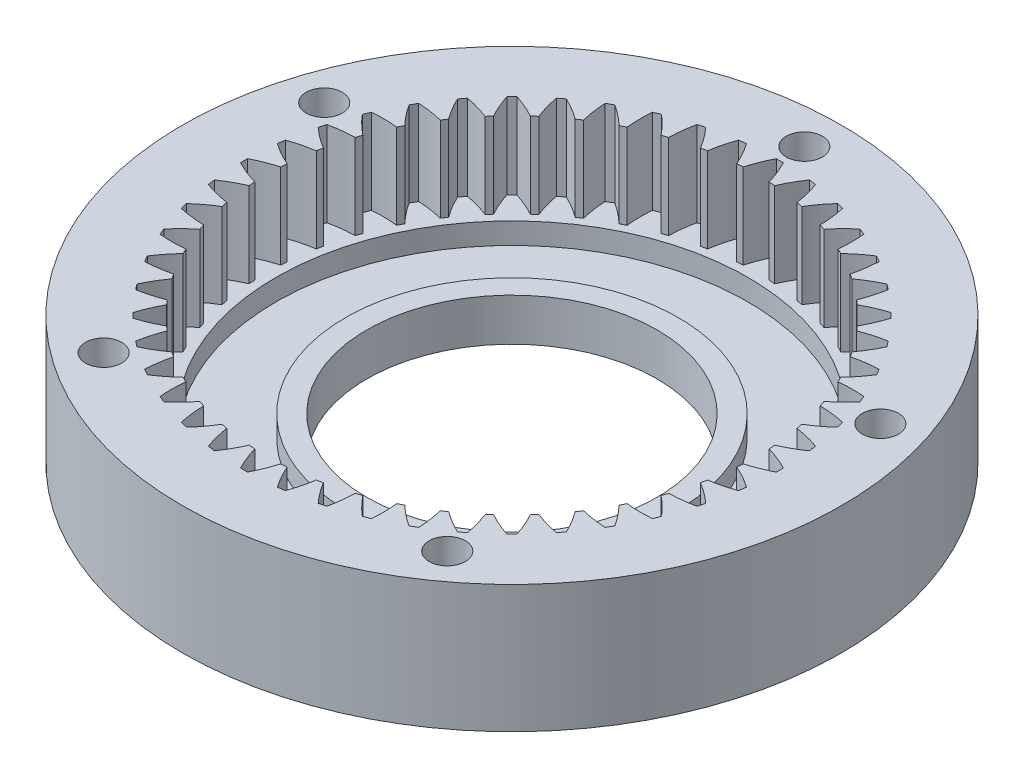
from build123d import *

# Parameters (mm, degrees)
ESQUISSE1_R                                  = 31
ESQUISSE1_R_2                                = 13.65
ESQUISSE1_R_3                                = 1.7
BOSS_EXTRU_1_DEPTH                           = 2
ESQUISSE2_R                                  = 15.65
ESQUISSE2_R_2                                = 13.65
BOSS_EXTRU_2_DEPTH                           = 2
ESQUISSE3_R                                  = 31
ESQUISSE3_R_2                                = 25.2
BOSS_EXTRU_3_DEPTH                           = 10
ESQUISSE7_R                                  = 1.7
ENL_V_MAT_EXTRU_2_DEPTH                      = 46.453272709
ESQUISSE8_R                                  = 25.2
ESQUISSE8_R_2                                = 22.2
BOSS_EXTRU_4_DEPTH                           = 2
ISO_START                                    = -0.630640537
ISO_INTERNAL_SPUR_GEAR_1M_48T_20PA_2_R       = 25.2764
ISO_INTERNAL_SPUR_GEAR_1M_48T_20PA_8FW_DEPTH = 8
CORPS_D_PLACER_COPIER6_ANGLE                 = 90


with BuildPart() as part:
    # Esquisse1 → Boss.-Extru.1 (new body)
    with BuildSketch(Plane(origin=(0, 0, 0), x_dir=(1, 0, 0), z_dir=(0, 1, 0))):
        with Locations(Location((0, 0, 0), (0, 0, 270))):
            Circle(ESQUISSE1_R)
        with Locations(Location((0, 0, 0), (0, 0, 270))):
            Circle(ESQUISSE1_R_2, mode=Mode.SUBTRACT)
        with Locations(Location((0, 27.5, 0), (0, 0, 270))):
            Circle(ESQUISSE1_R_3, mode=Mode.SUBTRACT)
        with Locations(Location((26.154054198, 8.497967345, 0), (0, 0, 270))):
            Circle(ESQUISSE1_R_3, mode=Mode.SUBTRACT)
        with Locations(Location((16.164094438, -22.247967345, 0), (0, 0, 270))):
            Circle(ESQUISSE1_R_3, mode=Mode.SUBTRACT)
        with Locations(Location((-16.164094438, -22.247967345, 0), (0, 0, 270))):
            Circle(ESQUISSE1_R_3, mode=Mode.SUBTRACT)
        with Locations(Location((-26.154054198, 8.497967345, 0), (0, 0, 270))):
            Circle(ESQUISSE1_R_3, mode=Mode.SUBTRACT)
    extrude(amount=BOSS_EXTRU_1_DEPTH)

    # Esquisse2 → Boss.-Extru.2 (add)
    with BuildSketch(Plane(origin=(0, 2, 0), x_dir=(1, 0, 0), z_dir=(0, 1, 0))):
        with Locations(Location((0, 0, 0), (0, 0, 270))):
            Circle(ESQUISSE2_R)
        with Locations(Location((0, 0, 0), (0, 0, 270))):
            Circle(ESQUISSE2_R_2, mode=Mode.SUBTRACT)
    extrude(amount=BOSS_EXTRU_2_DEPTH)

    # Esquisse3 → Boss.-Extru.3 (add)
    with BuildSketch(Plane(origin=(0, 2, 0), x_dir=(1, 0, 0), z_dir=(0, 1, 0))):
        with Locations(Location((0, 0, 0), (0, 0, 270))):
            Circle(ESQUISSE3_R)
        with Locations(Location((0, 0, 0), (0, 0, 270))):
            Circle(ESQUISSE3_R_2, mode=Mode.SUBTRACT)
    extrude(amount=BOSS_EXTRU_3_DEPTH)

    # Esquisse7 → Enlèv. mat.-Extru.2 (cut, through all)
    with BuildSketch(Plane.XZ):
        with Locations(Location((-26.154054198, -8.497967345, 0), (0, 0, 270))):
            Circle(ESQUISSE7_R)
        with Locations(Location((0, -27.5, 0), (0, 0, 270))):
            Circle(ESQUISSE7_R)
        with Locations(Location((26.154054198, -8.497967345, 0), (0, 0, 270))):
            Circle(ESQUISSE7_R)
        with Locations(Location((-16.164094438, 22.247967345, 0), (0, 0, 270))):
            Circle(ESQUISSE7_R)
        with Locations(Location((16.164094438, 22.247967345, 0), (0, 0, 270))):
            Circle(ESQUISSE7_R)
    extrude(amount=-ENL_V_MAT_EXTRU_2_DEPTH, mode=Mode.SUBTRACT)

    # Esquisse8 → Boss.-Extru.4 (add)
    with BuildSketch(Plane(origin=(0, 2, 0), x_dir=(1, 0, 0), z_dir=(0, 1, 0))):
        with Locations(Location((0, 0, 0), (0, 0, 270))):
            Circle(ESQUISSE8_R)
        with Locations(Location((0, 0, 0), (0, 0, 270))):
            Circle(ESQUISSE8_R_2, mode=Mode.SUBTRACT)
    extrude(amount=BOSS_EXTRU_4_DEPTH)


with BuildPart() as body_2:
    # ISO - Internal spur gear 1M 48T 20PA 8FW: read off the stored shape, not the designer's step
    # ISO - Internal spur gear 1M 48T 20PA 2 → ISO - Internal spur gear 1M 48T 20PA 8FW (new body)
    with BuildSketch(Plane.YZ.offset(ISO_START)):
        with Locations((15.09894857, -0.288936631)):
            Circle(ISO_INTERNAL_SPUR_GEAR_1M_48T_20PA_2_R)
        with BuildLine():
            ThreePointArc((40.348095514, -0.594844444), (39.230800177, -1.110970375), (38.06651592, -1.50994032))
            ThreePointArc((38.06651592, -1.50994032), (38.049703804, -1.793208603), (38.02939816, -2.076247908))
            ThreePointArc((38.02939816, -2.076247908), (39.131645776, -2.6237742), (40.172014544, -3.281320909))
            ThreePointArc((40.172014544, -3.281320909), (40.133922764, -3.58485351), (40.09215658, -3.887902367))
            ThreePointArc((40.09215658, -3.887902367), (38.917051907, -4.253776464), (37.710652235, -4.497363575))
            ThreePointArc((37.710652235, -4.497363575), (37.657010019, -4.776014037), (37.599934049, -5.053981483))
            ThreePointArc((37.599934049, -5.053981483), (38.621285262, -5.740695796), (39.566926463, -6.528412475))
            ThreePointArc((39.566926463, -6.528412475), (39.489541609, -6.824376338), (39.408576927, -7.11938099))
            ThreePointArc((39.408576927, -7.11938099), (38.195769284, -7.328743044), (36.967896031, -7.412779478))
            ThreePointArc((36.967896031, -7.412779478), (36.878341548, -7.682044332), (36.785471839, -7.950183819))
            ThreePointArc((36.785471839, -7.950183819), (37.708451046, -8.764336281), (38.543184497, -9.66874488))
            ThreePointArc((38.543184497, -9.66874488), (38.427830645, -9.952075981), (38.309052793, -10.233988815))
            ThreePointArc((38.309052793, -10.233988815), (37.079293656, -10.283256585), (35.850956073, -10.206304455))
            ThreePointArc((35.850956073, -10.206304455), (35.727021625, -10.461576506), (35.599947203, -10.715300092))
            ThreePointArc((35.599947203, -10.715300092), (36.408761974, -11.642960329), (37.118305154, -12.648586165))
            ThreePointArc((37.118305154, -12.648586165), (36.966956041, -12.914436631), (36.812397341, -13.17843404))
            ThreePointArc((36.812397341, -13.17843404), (35.586728229, -13.06676454), (34.378943513, -12.830140519))
            ThreePointArc((34.378943513, -12.830140519), (34.222749653, -13.06705199), (34.063644796, -13.302018396))
            ThreePointArc((34.063644796, -13.302018396), (34.744456087, -14.327313882), (35.316668515, -15.41695042))
            ThreePointArc((35.316668515, -15.41695042), (35.131913765, -15.660771474), (34.94421876, -15.902336391))
            ThreePointArc((34.94421876, -15.902336391), (33.743611212, -15.631640317), (32.577044894, -15.239393107))
            ThreePointArc((32.577044894, -15.239393107), (32.391264142, -15.453890378), (32.202851179, -15.666079263))
            ThreePointArc((32.202851179, -15.666079263), (32.744010119, -16.771466909), (33.169101082, -17.926470165))
            ThreePointArc((33.169101082, -17.926470165), (32.954101901, -18.144089962), (32.736482104, -18.359089143))
            ThreePointArc((32.736482104, -18.359089143), (31.581478848, -17.93399818), (30.476091202, -17.39283924))
            ThreePointArc((30.476091202, -17.39283924), (30.263902317, -17.581252203), (30.049405046, -17.767032955))
            ThreePointArc((30.049405046, -17.767032955), (30.441652256, -18.933599273), (30.71234833, -20.134206821))
            ThreePointArc((30.71234833, -20.134206821), (30.470783413, -20.321901826), (30.226962359, -20.506656576))
            ThreePointArc((30.226962359, -20.506656576), (29.137325821, -19.934444148), (28.112030335, -19.253632857))
            ThreePointArc((28.112030335, -19.253632857), (27.877063929, -19.412737714), (27.640152458, -19.568931574))
            ThreePointArc((27.640152458, -19.568931574), (27.876776479, -20.77671629), (27.988445979, -22.002385402))
            ThreePointArc((27.988445979, -22.002385402), (27.72444857, -22.156944102), (27.458598104, -22.308293215))
            ThreePointArc((27.458598104, -22.308293215), (26.452972268, -21.598750035), (25.525312032, -20.789935264))
            ThreePointArc((25.525312032, -20.789935264), (25.271588445, -20.917009686), (25.016316394, -21.040944134))
            ThreePointArc((25.016316394, -21.040944134), (25.093268524, -22.269281717), (25.044000754, -23.499040854))
            ThreePointArc((25.044000754, -23.499040854), (24.76208792, -23.617818706), (24.478756819, -23.733172558))
            ThreePointArc((24.478756819, -23.733172558), (23.57434822, -22.898439107), (22.760195758, -21.9754599))
            ThreePointArc((22.760195758, -21.9754599), (22.492056271, -22.068329609), (22.222791417, -22.157884092))
            ThreePointArc((22.222791417, -22.157884092), (22.138754983, -23.385757345), (21.929392929, -24.598564988))
            ThreePointArc((21.929392929, -24.598564988), (21.634388278, -24.67952967), (21.338424414, -24.756914524))
            ThreePointArc((21.338424414, -24.756914524), (20.550707735, -23.811273323), (19.863993422, -22.78992211))
            ThreePointArc((19.863993422, -22.78992211), (19.586025976, -22.84699808), (19.307375514, -22.900640296))
            ThreePointArc((19.307375514, -22.900640296), (19.063788403, -24.107039967), (18.697914306, -25.28214464))
            ThreePointArc((18.697914306, -25.28214464), (18.394865449, -25.323910825), (18.091332848, -25.362002605))
            ThreePointArc((18.091332848, -25.362002605), (17.433786139, -24.321633837), (16.886259847, -23.219386221))
            ThreePointArc((16.886259847, -23.219386221), (16.603220542, -23.239691865), (16.319952259, -23.256503981))
            ThreePointArc((16.319952259, -23.256503981), (15.920982314, -24.420788238), (15.404856383, -25.538083575))
            ThreePointArc((15.404856383, -25.538083575), (15.098948569, -25.539936631), (14.793040756, -25.538083575))
            ThreePointArc((14.793040756, -25.538083575), (14.276914825, -24.420788238), (13.87794488, -23.256503981))
            ThreePointArc((13.87794488, -23.256503981), (13.594676598, -23.239691865), (13.311637293, -23.219386221))
            ThreePointArc((13.311637293, -23.219386221), (12.764111, -24.321633836), (12.106564292, -25.362002605))
            ThreePointArc((12.106564292, -25.362002605), (11.80303169, -25.323910825), (11.499982833, -25.28214464))
            ThreePointArc((11.499982833, -25.28214464), (11.134108736, -24.107039967), (10.890521625, -22.900640296))
            ThreePointArc((10.890521625, -22.900640296), (10.611871163, -22.84699808), (10.333903717, -22.78992211))
            ThreePointArc((10.333903717, -22.78992211), (9.647189404, -23.811273323), (8.859472725, -24.756914524))
            ThreePointArc((8.859472725, -24.756914524), (8.563508862, -24.67952967), (8.268504211, -24.598564988))
            ThreePointArc((8.268504211, -24.598564988), (8.059142156, -23.385757345), (7.975105722, -22.157884092))
            ThreePointArc((7.975105722, -22.157884092), (7.705840868, -22.068329609), (7.437701381, -21.9754599))
            ThreePointArc((7.437701381, -21.9754599), (6.623548919, -22.898439107), (5.71914032, -23.733172558))
            ThreePointArc((5.71914032, -23.733172558), (5.435809219, -23.617818706), (5.153896385, -23.499040854))
            ThreePointArc((5.153896385, -23.499040854), (5.104628616, -22.269281717), (5.181580745, -21.040944134))
            ThreePointArc((5.181580745, -21.040944134), (4.926308695, -20.917009686), (4.672585108, -20.789935264))
            ThreePointArc((4.672585108, -20.789935264), (3.744924872, -21.598750035), (2.739299035, -22.308293215))
            ThreePointArc((2.739299035, -22.308293215), (2.47344857, -22.156944102), (2.20945116, -22.002385402))
            ThreePointArc((2.20945116, -22.002385402), (2.321120661, -20.776716291), (2.557744681, -19.568931574))
            ThreePointArc((2.557744681, -19.568931574), (2.32083321, -19.412737714), (2.085866804, -19.253632857))
            ThreePointArc((2.085866804, -19.253632857), (1.060571318, -19.934444148), (-0.02906522, -20.506656576))
            ThreePointArc((-0.02906522, -20.506656576), (-0.272886274, -20.321901826), (-0.514451191, -20.134206821))
            ThreePointArc((-0.514451191, -20.134206821), (-0.243755116, -18.933599273), (0.148492093, -17.767032955))
            ThreePointArc((0.148492093, -17.767032955), (-0.066005178, -17.581252203), (-0.278194062, -17.39283924))
            ThreePointArc((-0.278194062, -17.39283924), (-1.383581709, -17.93399818), (-2.538584965, -18.359089143))
            ThreePointArc((-2.538584965, -18.359089143), (-2.756204762, -18.144089962), (-2.971203943, -17.926470165))
            ThreePointArc((-2.971203943, -17.926470165), (-2.546112979, -16.77146691), (-2.00495404, -15.666079263))
            ThreePointArc((-2.00495404, -15.666079263), (-2.193367002, -15.453890378), (-2.379147755, -15.239393107))
            ThreePointArc((-2.379147755, -15.239393107), (-3.545714073, -15.631640317), (-4.746321621, -15.902336391))
            ThreePointArc((-4.746321621, -15.902336391), (-4.934016626, -15.660771474), (-5.118771376, -15.41695042))
            ThreePointArc((-5.118771376, -15.41695042), (-4.546558947, -14.327313882), (-3.865747657, -13.302018396))
            ThreePointArc((-3.865747657, -13.302018396), (-4.024852513, -13.06705199), (-4.181046374, -12.830140519))
            ThreePointArc((-4.181046374, -12.830140519), (-5.38883109, -13.06676454), (-6.614500201, -13.17843404))
            ThreePointArc((-6.614500201, -13.17843404), (-6.769058901, -12.91443663), (-6.920408015, -12.648586165))
            ThreePointArc((-6.920408015, -12.648586165), (-6.210864835, -11.642960329), (-5.402050064, -10.715300092))
            ThreePointArc((-5.402050064, -10.715300092), (-5.529124486, -10.461576506), (-5.653058934, -10.206304455))
            ThreePointArc((-5.653058934, -10.206304455), (-6.881396517, -10.283256585), (-8.111155654, -10.233988815))
            ThreePointArc((-8.111155654, -10.233988815), (-8.229933506, -9.952075981), (-8.345287357, -9.66874488))
            ThreePointArc((-8.345287357, -9.66874488), (-7.510553907, -8.764336281), (-6.5875747, -7.950183819))
            ThreePointArc((-6.5875747, -7.950183819), (-6.680444409, -7.682044332), (-6.769998892, -7.412779478))
            ThreePointArc((-6.769998892, -7.412779478), (-7.997872145, -7.328743044), (-9.210679787, -7.11938099))
            ThreePointArc((-9.210679787, -7.11938099), (-9.29164447, -6.824376339), (-9.369029324, -6.528412475))
            ThreePointArc((-9.369029324, -6.528412475), (-8.423388123, -5.740695796), (-7.40203691, -5.053981483))
            ThreePointArc((-7.40203691, -5.053981483), (-7.45911288, -4.776014037), (-7.512755096, -4.497363575))
            ThreePointArc((-7.512755096, -4.497363575), (-8.719154767, -4.253776464), (-9.89425944, -3.887902367))
            ThreePointArc((-9.89425944, -3.887902367), (-9.936025625, -3.58485351), (-9.974117404, -3.281320909))
            ThreePointArc((-9.974117404, -3.281320909), (-8.933748636, -2.6237742), (-7.83150102, -2.076247908))
            ThreePointArc((-7.83150102, -2.076247908), (-7.851806665, -1.793208603), (-7.868618781, -1.50994032))
            ThreePointArc((-7.868618781, -1.50994032), (-9.032903038, -1.110970375), (-10.150198375, -0.594844444))
            ThreePointArc((-10.150198375, -0.594844444), (-10.15205143, -0.288936631), (-10.150198375, 0.016971183))
            ThreePointArc((-10.150198375, 0.016971183), (-9.032903038, 0.533097114), (-7.868618781, 0.932067059))
            ThreePointArc((-7.868618781, 0.932067059), (-7.851806665, 1.215335341), (-7.83150102, 1.498374646))
            ThreePointArc((-7.83150102, 1.498374646), (-8.933748636, 2.045900939), (-9.974117404, 2.703447647))
            ThreePointArc((-9.974117404, 2.703447647), (-9.936025625, 3.006980249), (-9.89425944, 3.310029106))
            ThreePointArc((-9.89425944, 3.310029106), (-8.719154767, 3.675903203), (-7.512755096, 3.919490314))
            ThreePointArc((-7.512755096, 3.919490314), (-7.45911288, 4.198140776), (-7.40203691, 4.476108222))
            ThreePointArc((-7.40203691, 4.476108222), (-8.423388123, 5.162822535), (-9.369029324, 5.950539214))
            ThreePointArc((-9.369029324, 5.950539214), (-9.29164447, 6.246503077), (-9.210679787, 6.541507728))
            ThreePointArc((-9.210679787, 6.541507728), (-7.997872145, 6.750869783), (-6.769998892, 6.834906217))
            ThreePointArc((-6.769998892, 6.834906217), (-6.680444409, 7.104171071), (-6.5875747, 7.372310558))
            ThreePointArc((-6.5875747, 7.372310558), (-7.510553907, 8.18646302), (-8.345287357, 9.090871619))
            ThreePointArc((-8.345287357, 9.090871619), (-8.229933506, 9.37420272), (-8.111155654, 9.656115554))
            ThreePointArc((-8.111155654, 9.656115554), (-6.881396517, 9.705383323), (-5.653058934, 9.628431194))
            ThreePointArc((-5.653058934, 9.628431194), (-5.529124486, 9.883703244), (-5.402050064, 10.137426831))
            ThreePointArc((-5.402050064, 10.137426831), (-6.210864835, 11.065087067), (-6.920408015, 12.070712904))
            ThreePointArc((-6.920408015, 12.070712904), (-6.769058901, 12.336563369), (-6.614500201, 12.600560779))
            ThreePointArc((-6.614500201, 12.600560779), (-5.38883109, 12.488891279), (-4.181046374, 12.252267258))
            ThreePointArc((-4.181046374, 12.252267258), (-4.024852513, 12.489178729), (-3.865747657, 12.724145135))
            ThreePointArc((-3.865747657, 12.724145135), (-4.546558947, 13.749440621), (-5.118771376, 14.839077159))
            ThreePointArc((-5.118771376, 14.839077159), (-4.934016626, 15.082898213), (-4.746321621, 15.32446313))
            ThreePointArc((-4.746321621, 15.32446313), (-3.545714073, 15.053767055), (-2.379147755, 14.661519846))
            ThreePointArc((-2.379147755, 14.661519846), (-2.193367002, 14.876017117), (-2.00495404, 15.088206001))
            ThreePointArc((-2.00495404, 15.088206001), (-2.546112979, 16.193593648), (-2.971203943, 17.348596904))
            ThreePointArc((-2.971203943, 17.348596904), (-2.756204762, 17.566216701), (-2.538584965, 17.781215882))
            ThreePointArc((-2.538584965, 17.781215882), (-1.383581709, 17.356124919), (-0.278194062, 16.814965979))
            ThreePointArc((-0.278194062, 16.814965979), (-0.066005178, 17.003378941), (0.148492093, 17.189159694))
            ThreePointArc((0.148492093, 17.189159694), (-0.243755116, 18.355726012), (-0.514451191, 19.55633356))
            ThreePointArc((-0.514451191, 19.55633356), (-0.272886274, 19.744028565), (-0.02906522, 19.928783315))
            ThreePointArc((-0.02906522, 19.928783315), (1.060571318, 19.356570886), (2.085866804, 18.675759596))
            ThreePointArc((2.085866804, 18.675759596), (2.32083321, 18.834864452), (2.557744681, 18.991058313))
            ThreePointArc((2.557744681, 18.991058313), (2.321120661, 20.198843029), (2.20945116, 21.42451214))
            ThreePointArc((2.20945116, 21.42451214), (2.47344857, 21.57907084), (2.739299035, 21.730419954))
            ThreePointArc((2.739299035, 21.730419954), (3.744924872, 21.020876774), (4.672585108, 20.212062003))
            ThreePointArc((4.672585108, 20.212062003), (4.926308695, 20.339136425), (5.181580745, 20.463070873))
            ThreePointArc((5.181580745, 20.463070873), (5.104628616, 21.691408456), (5.153896385, 22.921167593))
            ThreePointArc((5.153896385, 22.921167593), (5.435809219, 23.039945445), (5.71914032, 23.155299296))
            ThreePointArc((5.71914032, 23.155299296), (6.623548919, 22.320565846), (7.437701381, 21.397586639))
            ThreePointArc((7.437701381, 21.397586639), (7.705840868, 21.490456348), (7.975105722, 21.580010831))
            ThreePointArc((7.975105722, 21.580010831), (8.059142156, 22.807884084), (8.268504211, 24.020691726))
            ThreePointArc((8.268504211, 24.020691726), (8.563508862, 24.101656409), (8.859472725, 24.179041263))
            ThreePointArc((8.859472725, 24.179041263), (9.647189404, 23.233400062), (10.333903717, 22.212048849))
            ThreePointArc((10.333903717, 22.212048849), (10.611871163, 22.269124819), (10.890521625, 22.322767035))
            ThreePointArc((10.890521625, 22.322767035), (11.134108736, 23.529166706), (11.499982833, 24.704271379))
            ThreePointArc((11.499982833, 24.704271379), (11.80303169, 24.746037564), (12.106564292, 24.784129343))
            ThreePointArc((12.106564292, 24.784129343), (12.764111, 23.743760575), (13.311637293, 22.641512959))
            ThreePointArc((13.311637293, 22.641512959), (13.594676598, 22.661818604), (13.87794488, 22.67863072))
            ThreePointArc((13.87794488, 22.67863072), (14.276914825, 23.842914977), (14.793040756, 24.960210314))
            ThreePointArc((14.793040756, 24.960210314), (15.09894857, 24.962063369), (15.404856383, 24.960210314))
            ThreePointArc((15.404856383, 24.960210314), (15.920982314, 23.842914977), (16.319952259, 22.67863072))
            ThreePointArc((16.319952259, 22.67863072), (16.603220542, 22.661818604), (16.886259847, 22.641512959))
            ThreePointArc((16.886259847, 22.641512959), (17.433786139, 23.743760575), (18.091332848, 24.784129343))
            ThreePointArc((18.091332848, 24.784129343), (18.394865449, 24.746037564), (18.697914306, 24.704271379))
            ThreePointArc((18.697914306, 24.704271379), (19.063788403, 23.529166706), (19.307375514, 22.322767035))
            ThreePointArc((19.307375514, 22.322767035), (19.586025976, 22.269124819), (19.863993422, 22.212048849))
            ThreePointArc((19.863993422, 22.212048849), (20.550707735, 23.233400062), (21.338424414, 24.179041263))
            ThreePointArc((21.338424414, 24.179041263), (21.634388278, 24.101656409), (21.929392929, 24.020691726))
            ThreePointArc((21.929392929, 24.020691726), (22.138754983, 22.807884084), (22.222791417, 21.580010831))
            ThreePointArc((22.222791417, 21.580010831), (22.492056271, 21.490456348), (22.760195758, 21.397586639))
            ThreePointArc((22.760195758, 21.397586639), (23.57434822, 22.320565846), (24.478756819, 23.155299296))
            ThreePointArc((24.478756819, 23.155299296), (24.76208792, 23.039945445), (25.044000754, 22.921167593))
            ThreePointArc((25.044000754, 22.921167593), (25.093268524, 21.691408456), (25.016316394, 20.463070873))
            ThreePointArc((25.016316394, 20.463070873), (25.271588445, 20.339136425), (25.525312032, 20.212062003))
            ThreePointArc((25.525312032, 20.212062003), (26.452972268, 21.020876774), (27.458598104, 21.730419954))
            ThreePointArc((27.458598104, 21.730419954), (27.724448569, 21.57907084), (27.988445979, 21.42451214))
            ThreePointArc((27.988445979, 21.42451214), (27.876776479, 20.198843029), (27.640152458, 18.991058313))
            ThreePointArc((27.640152458, 18.991058313), (27.877063929, 18.834864452), (28.112030335, 18.675759596))
            ThreePointArc((28.112030335, 18.675759596), (29.137325821, 19.356570886), (30.226962359, 19.928783315))
            ThreePointArc((30.226962359, 19.928783315), (30.470783413, 19.744028565), (30.71234833, 19.55633356))
            ThreePointArc((30.71234833, 19.55633356), (30.441652256, 18.355726012), (30.049405046, 17.189159694))
            ThreePointArc((30.049405046, 17.189159694), (30.263902317, 17.003378941), (30.476091202, 16.814965979))
            ThreePointArc((30.476091202, 16.814965979), (31.581478848, 17.356124919), (32.736482104, 17.781215882))
            ThreePointArc((32.736482104, 17.781215882), (32.954101901, 17.566216701), (33.169101082, 17.348596904))
            ThreePointArc((33.169101082, 17.348596904), (32.744010119, 16.193593648), (32.202851179, 15.088206001))
            ThreePointArc((32.202851179, 15.088206001), (32.391264142, 14.876017117), (32.577044894, 14.661519846))
            ThreePointArc((32.577044894, 14.661519846), (33.743611212, 15.053767055), (34.94421876, 15.32446313))
            ThreePointArc((34.94421876, 15.32446313), (35.131913765, 15.082898213), (35.316668515, 14.839077159))
            ThreePointArc((35.316668515, 14.839077159), (34.744456087, 13.749440621), (34.063644796, 12.724145135))
            ThreePointArc((34.063644796, 12.724145135), (34.222749653, 12.489178729), (34.378943513, 12.252267258))
            ThreePointArc((34.378943513, 12.252267258), (35.586728229, 12.488891279), (36.812397341, 12.600560779))
            ThreePointArc((36.812397341, 12.600560779), (36.966956041, 12.336563369), (37.118305154, 12.070712904))
            ThreePointArc((37.118305154, 12.070712904), (36.408761974, 11.065087067), (35.599947203, 10.137426831))
            ThreePointArc((35.599947203, 10.137426831), (35.727021625, 9.883703244), (35.850956073, 9.628431194))
            ThreePointArc((35.850956073, 9.628431194), (37.079293656, 9.705383323), (38.309052793, 9.656115554))
            ThreePointArc((38.309052793, 9.656115554), (38.427830645, 9.37420272), (38.543184497, 9.090871619))
            ThreePointArc((38.543184497, 9.090871619), (37.708451046, 8.18646302), (36.785471839, 7.372310558))
            ThreePointArc((36.785471839, 7.372310558), (36.878341548, 7.104171071), (36.967896031, 6.834906217))
            ThreePointArc((36.967896031, 6.834906217), (38.195769284, 6.750869783), (39.408576927, 6.541507728))
            ThreePointArc((39.408576927, 6.541507728), (39.489541609, 6.246503077), (39.566926463, 5.950539214))
            ThreePointArc((39.566926463, 5.950539214), (38.621285262, 5.162822535), (37.599934049, 4.476108222))
            ThreePointArc((37.599934049, 4.476108222), (37.657010019, 4.198140776), (37.710652235, 3.919490314))
            ThreePointArc((37.710652235, 3.919490314), (38.917051907, 3.675903203), (40.09215658, 3.310029106))
            ThreePointArc((40.09215658, 3.310029106), (40.133922764, 3.006980249), (40.172014544, 2.703447647))
            ThreePointArc((40.172014544, 2.703447647), (39.131645775, 2.045900939), (38.02939816, 1.498374646))
            ThreePointArc((38.02939816, 1.498374646), (38.049703804, 1.215335341), (38.06651592, 0.932067059))
            ThreePointArc((38.06651592, 0.932067059), (39.230800177, 0.533097114), (40.348095514, 0.016971183))
            ThreePointArc((40.348095514, 0.016971183), (40.34994857, -0.288936631), (40.348095514, -0.594844444))
        make_face(mode=Mode.SUBTRACT)
    extrude(amount=ISO_INTERNAL_SPUR_GEAR_1M_48T_20PA_8FW_DEPTH)


with BuildPart() as body_2_1:
    # Corps-Déplacer/Copier6: read off the stored shape, not the designer's step
    # Corps-Déplacer/Copier6: moved
    add(body_2.part.moved(Location((4.6306405, -15.0989486, 0.2889366))).rotate(Axis((0, 0, 0), (0, 0, 1)), CORPS_D_PLACER_COPIER6_ANGLE))


with BuildPart() as part_1:
    add(part.part)

    # Combiner1: union body 2
    add(body_2_1.part)


solid = part_1.part
